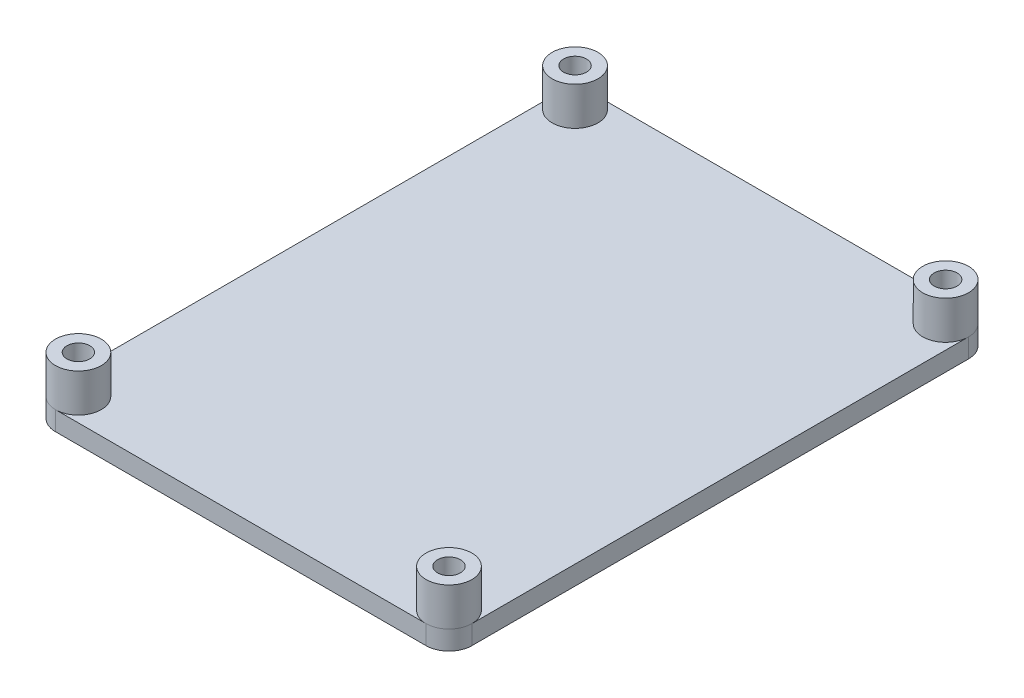
from build123d import *

# Parameters (mm, degrees)
SKETCH1_W           = 54.5
SKETCH1_H           = 71
BOSS_EXTRUDE1_DEPTH = 2.5
SKETCH2_R           = 3
BOSS_EXTRUDE2_DEPTH = 5
FILLET1_R           = 3
SKETCH3_R           = 1.5
CUT_EXTRUDE1_DEPTH  = 7.5


with BuildPart() as part:
    # Sketch1 → Boss-Extrude1 (new body)
    with BuildSketch(Plane(origin=(0, 0, 0), x_dir=(1, 0, 0), z_dir=(0, 1, 0))):
        with Locations((-42.847381712, -51.275024631)):
            Rectangle(SKETCH1_W, SKETCH1_H)
    extrude(amount=BOSS_EXTRUDE1_DEPTH)

    # Sketch2 → Boss-Extrude2 (add)
    with BuildSketch(Plane(origin=(0, 2.5, 0), x_dir=(1, 0, 0), z_dir=(0, 1, 0))):
        with Locations(Location((-67.097381712, -18.775024631, 0), (0, 0, 90))):
            Circle(SKETCH2_R)
        with Locations(Location((-18.597381712, -18.775024631, 0), (0, 0, 90))):
            Circle(SKETCH2_R)
        with Locations(Location((-18.597381712, -83.775024631, 0), (0, 0, 270))):
            Circle(SKETCH2_R)
        with Locations(Location((-67.097381712, -83.775024631, 0), (0, 0, 270))):
            Circle(SKETCH2_R)
    extrude(amount=BOSS_EXTRUDE2_DEPTH)

    # Fillet1
    fillet1_edges = [part.edges().sort_by_distance(p)[0] for p in [
        (-70.097381712, 1.25, 15.775024631),
        (-15.597381712, 1.25, 15.775024631),
        (-15.597381712, 1.25, 86.775024631),
        (-70.097381712, 1.25, 86.775024631),
    ]]
    fillet(fillet1_edges, radius=FILLET1_R - 0.0001)  # a hair under: the kernel refuses the full size

    # Sketch3 → Cut-Extrude1 (cut)
    with BuildSketch(Plane(origin=(0, 7.5, 0), x_dir=(1, 0, 0), z_dir=(0, 1, 0))):
        with Locations(Location((-67.097381712, -18.775024631, 0), (0, 0, 270))):
            Circle(SKETCH3_R)
        with Locations(Location((-18.597381712, -18.775024631, 0), (0, 0, 270))):
            Circle(SKETCH3_R)
        with Locations(Location((-18.597381712, -83.775024631, 0), (0, 0, 270))):
            Circle(SKETCH3_R)
        with Locations(Location((-67.097381712, -83.775024631, 0), (0, 0, 270))):
            Circle(SKETCH3_R)
    extrude(amount=-CUT_EXTRUDE1_DEPTH, mode=Mode.SUBTRACT)


solid = part.part
